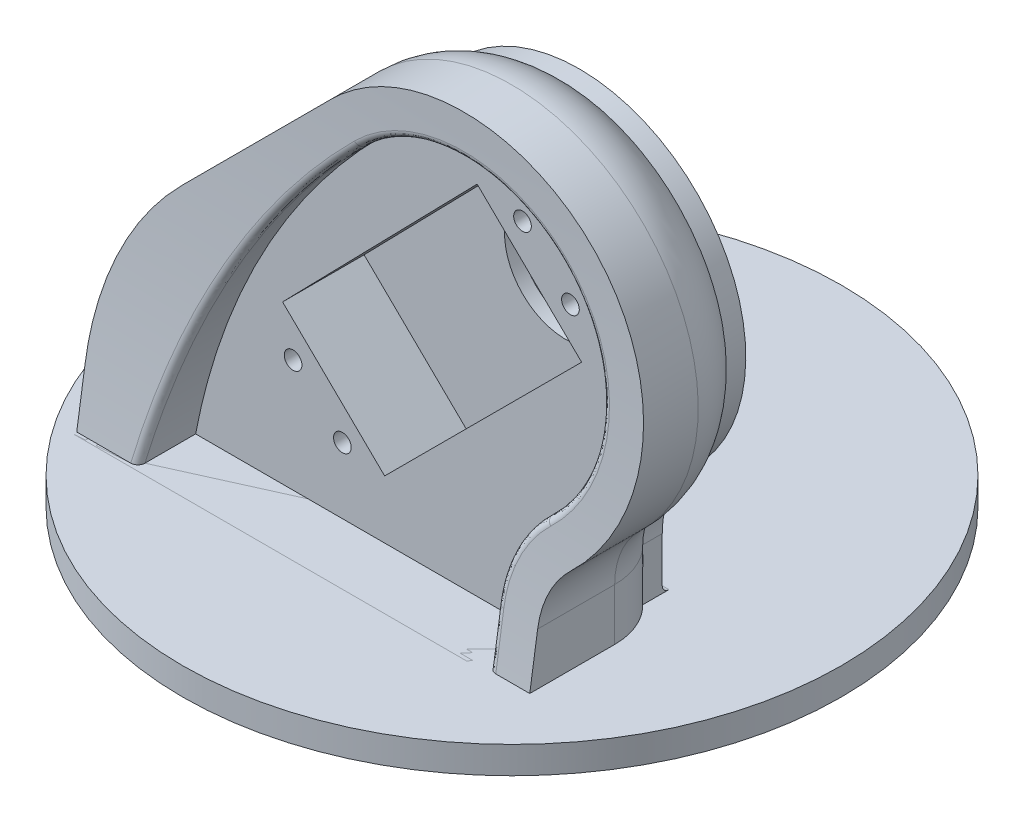
from build123d import *

# Parameters (mm, degrees)
SKETCH_1_R               = 48.5
SKETCH_1_R_2             = 1.5
EXTRUDE_1_DEPTH          = 4
SKETCH_2_R               = 3.75
CUT_EXTRUDE_1_DEPTH      = 1.5
SKETCH_3_R               = 9
EXTRUDE_2_DEPTH          = 14
SKETCH_4_R               = 1.3
CUT_EXTRUDE_2_DEPTH      = 98.565098268
EXTRUDE_3_DEPTH          = 9
EXTRUDE_3_DEPTH_BACK     = 14
CUT_EXTRUDE_3_DEPTH      = 97.429395933
CUT_EXTRUDE_3_DEPTH_BACK = 97.429395933
FILLET_2_R               = 10
FILLET_3_R               = 1
FILLET_4_R               = 1


with BuildPart() as part:
    # 草图1 → 凸台-拉伸1 (new body)
    with BuildSketch(Plane(origin=(0, 0, 0), x_dir=(1, 0, 0), z_dir=(0, 1, 0))):
        with Locations(Location((0, 0, 0), (0, 0, 270))):
            Circle(SKETCH_1_R)
        with Locations(Location((-7.25, 0, 0), (0, 0, 270))):
            Circle(SKETCH_1_R_2, mode=Mode.SUBTRACT)
        with Locations(Location((7.25, 0, 0), (0, 0, 270))):
            Circle(SKETCH_1_R_2, mode=Mode.SUBTRACT)
    extrude(amount=EXTRUDE_1_DEPTH)

    # 草图2 → 切除-拉伸1 (cut)
    with BuildSketch(Plane.XZ):
        with Locations(Location((0, 0, 0), (0, 0, 270))):
            Circle(SKETCH_2_R)
    extrude(amount=-CUT_EXTRUDE_1_DEPTH, mode=Mode.SUBTRACT)

    # 草图3 → 凸台-拉伸2 (add)
    with BuildSketch(Plane.XY.offset(4)):
        with BuildLine():
            Line((-34.56705163, 4), (-34.56705163, 11.86))
            ThreePointArc((-34.56705163, 11.86), (-31.885614823, 25.340493156), (-24.249528849, 36.768703429))
            Line((-24.249528849, 36.768703429), (-3.414116139, 57.604116139))
            ThreePointArc((-3.414116139, 57.604116139), (31.45553512, 57.379830331), (30.782714812, 22.515949367))
            ThreePointArc((30.782714812, 22.515949367), (27.329742948, 17.558044298), (26.11294837, 11.64))
            Line((26.11294837, 11.64), (26.11294837, 4))
            Line((26.11294837, 4), (-34.56705163, 4))
        make_face()
        with Locations((13.91, 40.28)):
            Circle(SKETCH_3_R, mode=Mode.SUBTRACT)
    extrude(amount=EXTRUDE_2_DEPTH)

    # 草图4 → 切除-拉伸2 (cut, through all)
    with BuildSketch(Plane.XY.offset(6)):
        with Locations(Location((19.546542124, 55.178549796, 0), (0, 0, 180))):
            Circle(SKETCH_4_R)
        with Locations(Location((26.602531946, 48.090998319, 0), (0, 0, 180))):
            Circle(SKETCH_4_R)
        with Locations(Location((-6.967386614, 13.702634099, 0), (0, 0, 180))):
            Circle(SKETCH_4_R)
        with Locations(Location((-14.222813318, 20.585886357, 0), (0, 0, 180))):
            Circle(SKETCH_4_R)
        Polygon((12.869632294, 56.565852763), (28.249952432, 41.551585403), (-0.74352801, 12.558104962), (-15.770515363, 27.227448883), align=None)
    extrude(amount=CUT_EXTRUDE_2_DEPTH, mode=Mode.SUBTRACT)

    # 圆角3
    fillet_3_edges = [part.edges().sort_by_distance(p)[0] for p in [
        (-4.22705163, 4, 4),
    ]]
    fillet(fillet_3_edges, radius=FILLET_3_R)


with BuildPart() as body_2:
    # 草图5 → 凸台-拉伸3 (new, two sides: drawn at the far end of the back side and taken through both)
    with BuildSketch(Plane.XY.offset(18).offset(-EXTRUDE_3_DEPTH_BACK)):
        with BuildLine():
            Line((-5.535436483, 59.725436483), (-26.370849192, 38.890023773))
            ThreePointArc((-26.370849192, 38.890023773), (-34.657253421, 26.488543453), (-37.56705163, 11.86))
            Line((-37.56705163, 11.86), (-37.56705163, 1))
            Line((-37.56705163, 1), (29.11294837, 1))
            Line((29.11294837, 1), (29.11294837, 6.593488926))
            Line((29.11294837, 6.593488926), (29.11294837, 11.64))
            ThreePointArc((29.11294837, 11.64), (30.086384033, 16.374435438), (32.848761523, 20.340759494))
            ThreePointArc((32.848761523, 20.340759494), (33.603967992, 59.473687106), (-5.535436483, 59.725436483))
        make_face()
        with BuildLine():
            Line((-28.56705163, 4), (23.11294837, 4))
            Line((23.11294837, 4), (23.11294837, 7))
            Line((23.11294837, 7), (23.11294837, 11.64))
            ThreePointArc((23.11294837, 11.64), (24.573101864, 18.741653158), (28.7166681, 24.691139241))
            ThreePointArc((28.7166681, 24.691139241), (29.307102248, 55.285973556), (-1.292795796, 55.482795796))
            ThreePointArc((-1.292795796, 55.482795796), (-18.79687153, 31.790007), (-28.56705163, 4))
        make_face(mode=Mode.SUBTRACT)
    extrude(amount=EXTRUDE_3_DEPTH + EXTRUDE_3_DEPTH_BACK)

    # 草图6 → 切除-拉伸3 (cut, two sides: drawn at the far end of the back side and taken through both)
    with BuildSketch(Plane(origin=(0, 0, 0), x_dir=(0, 0, -1), z_dir=(1, 0, 0)).offset(-CUT_EXTRUDE_3_DEPTH_BACK)):
        with BuildLine():
            Line((-27, 20.340759494), (-27, 11.64))
            Line((-27, 11.64), (-27, 4))
            Line((-27, 4), (-26.5, 4))
            add(Edge.make_bspline(
                [(-21, 67.78), (-21, 52.164731901), (-22.199698882, 30.917592968), (-26.5, 4)],
                knots=[0, 0, 0, 0, 1, 1, 1, 1], degree=3))
            Line((-21, 67.78), (-27, 67.78))
            Line((-27, 67.78), (-27, 20.340759494))
        make_face()
    extrude(amount=CUT_EXTRUDE_3_DEPTH + CUT_EXTRUDE_3_DEPTH_BACK, mode=Mode.SUBTRACT)

    # 圆角2
    # the kernel refuses this fillet: 10 mm, written as the material it takes off along each edge
    with BuildSketch(Plane(origin=(29.11294837, -24, 4), x_dir=(0, 0, 1), z_dir=(0, 1, 0))) as fillet_2_piece_1:
        with BuildLine():
            CenterArc((FILLET_2_R, -FILLET_2_R), FILLET_2_R, 90, 90)
            Line((0, -FILLET_2_R), (0, 0))
            Line((0, 0), (FILLET_2_R, 0))
        make_face()
    extrude(amount=35.64, mode=Mode.SUBTRACT)
    with BuildSketch(Plane(origin=(-5.535436483, 59.725436483, 4), x_dir=(0, 0, 1), z_dir=(-0.7071067811865515, -0.7071067811865437, 0))) as fillet_2_piece_2:
        with BuildLine():
            CenterArc((FILLET_2_R, -FILLET_2_R), FILLET_2_R, 90, 90)
            Line((0, -FILLET_2_R), (0, 0))
            Line((0, 0), (FILLET_2_R, 0))
        make_face()
    extrude(amount=29.465723232, mode=Mode.SUBTRACT)
    with BuildSketch(Plane(origin=(-37.56705163, 11.86, 4), x_dir=(0, 0, 1), z_dir=(0, -1, 0))) as fillet_2_piece_3:
        with BuildLine():
            CenterArc((FILLET_2_R, -FILLET_2_R), FILLET_2_R, 90, 90)
            Line((0, -FILLET_2_R), (0, 0))
            Line((0, 0), (FILLET_2_R, 0))
        make_face()
    extrude(amount=35.86, mode=Mode.SUBTRACT)
    with BuildSketch(Plane(origin=(0.65917458, 11.86, 4), x_dir=(-0.7071067811865439, 0.7071067811865511, 0), z_dir=(0.7071067811865511, 0.7071067811865439, 0))) as fillet_2_piece_4:
        with BuildLine():
            CenterArc((38.226226211 - FILLET_2_R, FILLET_2_R), FILLET_2_R, 270, 90)
            Line((38.226226211 - FILLET_2_R, 0), (38.226226211, 0))
            Line((38.226226211, 0), (38.226226211, FILLET_2_R))
        make_face()
    revolve(axis=Axis((0.65917458, 11.86, 4), (0, 0, 1)), revolution_arc=45, mode=Mode.SUBTRACT)
    with BuildSketch(Plane(origin=(13.91, 40.28, 4), x_dir=(0.6886822372054716, -0.7250632911392402, 0), z_dir=(-0.7250632911392402, -0.6886822372054716, 0))) as fillet_2_piece_5:
        with BuildLine():
            CenterArc((27.5 - FILLET_2_R, FILLET_2_R), FILLET_2_R, 270, 90)
            Line((27.5 - FILLET_2_R, 0), (27.5, 0))
            Line((27.5, 0), (27.5, FILLET_2_R))
        make_face()
    revolve(axis=Axis((13.91, 40.28, 4), (0, 0, 1)), revolution_arc=181.474113163, mode=Mode.SUBTRACT)
    with BuildSketch(Plane(origin=(41.11294837, 11.64, 4), x_dir=(-1, 0, 0), z_dir=(0, -1, 0))) as fillet_2_piece_6:
        with BuildLine():
            CenterArc((12 + FILLET_2_R, -FILLET_2_R), FILLET_2_R, 90, 90)
            Line((12, -FILLET_2_R), (12, 0))
            Line((12, 0), (12 + FILLET_2_R, 0))
        make_face()
    revolve(axis=Axis((41.11294837, 11.64, 4), (0, 0, -1)), revolution_arc=46.474113163, mode=Mode.SUBTRACT)

    # 圆角4
    fillet_4_edges = [body_2.edges().sort_by_distance(p)[0] for p in [
        (23.11294837, 7.817769203, 25.904891393),
        (24.5676878, 18.729030489, 24.371604868),
        (29.937078347, 54.611181357, 21.270499322),
        (-18.837959163, 31.712366928, 22.88779981),
    ]]
    fillet(fillet_4_edges, radius=FILLET_4_R)


solid = Compound([part.part, body_2.part])
